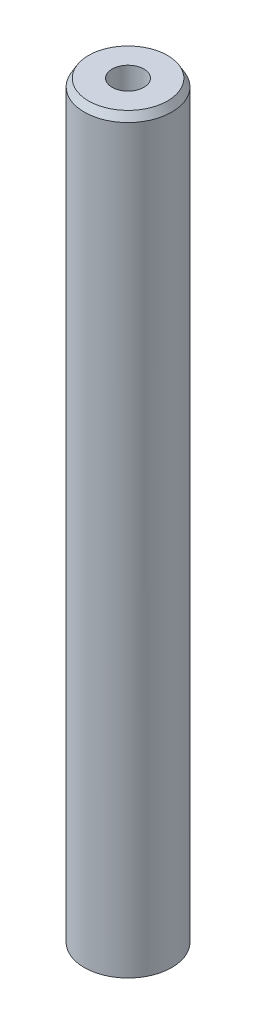
from build123d import *
from OCP.BRepFilletAPI import BRepFilletAPI_MakeChamfer

# Parameters (mm, degrees)
SKETCH1_R           = 12.5
BOSS_EXTRUDE1_DEPTH = 214.813731431
SKETCH2_R           = 4.535296276
CUT_EXTRUDE1_DEPTH  = 216.539878471
CHAMFER1_SIZE       = 2.136714601
CHAMFER1_SIZE2      = 1.23363275


with BuildPart() as part:
    # Sketch1 → Boss-Extrude1 (new body)
    with BuildSketch(Plane(origin=(0, 0, 0), x_dir=(1, 0, 0), z_dir=(0, 1, 0))):
        Circle(SKETCH1_R)
    extrude(amount=BOSS_EXTRUDE1_DEPTH)

    # Sketch2 → Cut-Extrude1 (cut, through all)
    with BuildSketch(Plane(origin=(0, 0, 0), x_dir=(1, 0, 0), z_dir=(0, 1, 0))):
        Circle(SKETCH2_R)
    extrude(amount=CUT_EXTRUDE1_DEPTH, mode=Mode.SUBTRACT)

    # Chamfer1: one chamfer whose edges measure the first distance from different faces: ONE call of the kernel's chamfer builder (chamfer() names one face for all edges)
    chamfer1_edges_1 = [part.edges().sort_by_distance(p)[0] for p in [
        (-12.5, 214.813731431, 0),
    ]]
    chamfer1_side_1 = [part.faces().sort_by_distance(p)[0] for p in [
        (-12.5, 107.406865716, 0),
    ]]
    chamfer1_edges_2 = [part.edges().sort_by_distance(p)[0] for p in [
        (-12.5, 0, 0),
    ]]
    chamfer1_side_2 = [part.faces().sort_by_distance(p)[0] for p in [
        (-12.146446609, 0, 0),
    ]]
    chamfer1 = BRepFilletAPI_MakeChamfer(part.part.solid().wrapped)
    for e in chamfer1_edges_1:
        chamfer1.Add(CHAMFER1_SIZE, CHAMFER1_SIZE2, e.wrapped, chamfer1_side_1[0].wrapped)  # the first distance lies on this face
    for e in chamfer1_edges_2:
        chamfer1.Add(CHAMFER1_SIZE, CHAMFER1_SIZE2, e.wrapped, chamfer1_side_2[0].wrapped)  # the first distance lies on this face
    add(Compound.cast(chamfer1.Shape()), mode=Mode.REPLACE)


solid = part.part
